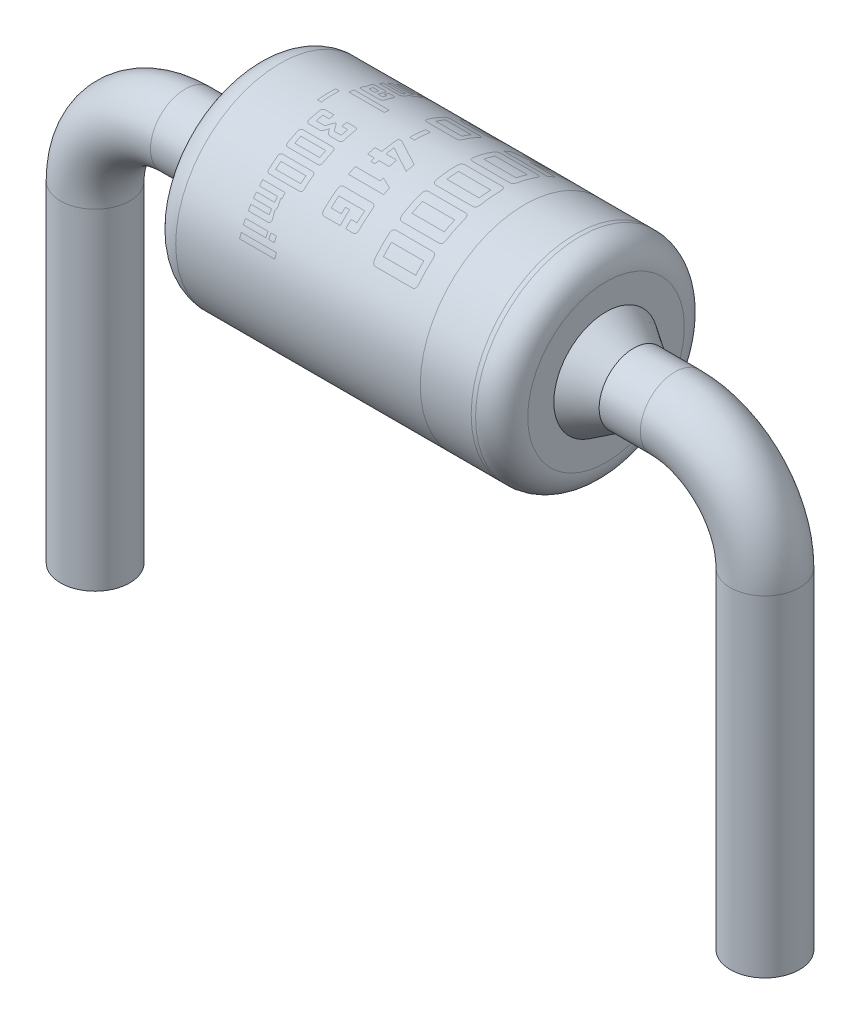
from build123d import *

# Parameters (mm, degrees)
SKETCH6_R = 0.39375


with BuildPart() as part:
    # Sketch10 → BODY_main (revolve)
    with BuildSketch(Plane.XY):
        with BuildLine():
            Line((2.104375, 3.375), (5.515625, 3.375))
            ThreePointArc((5.515625, 3.375), (5.725547326, 3.288047326), (5.8125, 3.078125))
            Line((5.8125, 3.078125), (5.8125, 2.78125))
            Line((5.8125, 2.78125), (1.8075, 2.78125))
            Line((1.8075, 2.78125), (1.8075, 3.078125))
            ThreePointArc((1.8075, 3.078125), (1.894452674, 3.288047326), (2.104375, 3.375))
        make_face()
    revolve(axis=Axis((1.4925, 2.1875, 0), (1, 0, 0)))

    # Sketch11 → BODY_to_PIN (revolve)
    with BuildSketch(Plane.XY):
        Polygon((1.4925, 2.1875), (1.4925, 2.58125), (1.8075, 2.78125), (2.0075, 2.78125), (2.0075, 2.1875), align=None)
        Polygon((5.6125, 2.1875), (5.6125, 2.78125), (5.8125, 2.78125), (6.1275, 2.58125), (6.1275, 2.1875), align=None)
    revolve(axis=Axis((1.4925, 2.1875, 0), (1, 0, 0)))

    # PINS: sweep along a path in Sketch7
    with BuildLine(Plane.XY) as pins_path:
        Line((0, -2.6), (0, 1.16375))
        ThreePointArc((0, 1.16375), (0.299849433, 1.887650567), (1.02375, 2.1875))
        Line((1.02375, 2.1875), (6.59625, 2.1875))
        ThreePointArc((6.59625, 2.1875), (7.320150567, 1.887650567), (7.62, 1.16375))
        Line((7.62, 1.16375), (7.62, -2.6))
    # Sketch6 → PINS (sweep)
    with BuildSketch(Plane(origin=(3.81, 0, 0), x_dir=(0, 0, -1), z_dir=(1, 0, 0))):
        with Locations((0, 2.1875)):
            Circle(SKETCH6_R)
    sweep(path=pins_path.line)


solid = part.part
